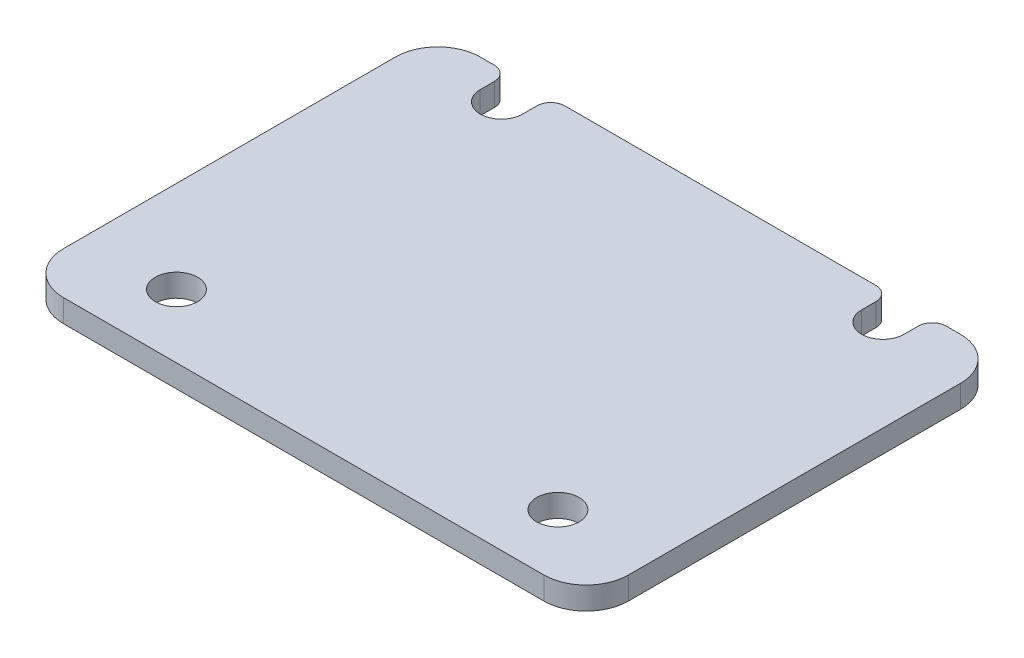
from build123d import *

# Parameters (mm, degrees)
SKETCH1_W                = 40
SKETCH1_H                = 29.5
BOSS_EXTRUDE1_DEPTH      = 1.6
FILLET1_R                = 3
M2_CLEARANCE_HOLE1_D     = 3
M2_CLEARANCE_HOLE1_DEPTH = 5.2
M2_CLEARANCE_HOLE1_TIP   = 0.901290929
CUT_EXTRUDE1_DEPTH       = 25.902258934
CUT_EXTRUDE1_DEPTH_BACK  = 25.902258934
FILLET2_R                = 1
SKETCH11_W               = 30
SKETCH11_H               = 28.944863729
SKETCH11_R               = 1
CUT_EXTRUDE3_DEPTH       = 0.001


with BuildPart() as part:
    # Sketch1 → Boss-Extrude1 (new body)
    with BuildSketch(Plane(origin=(0, 0, 0), x_dir=(1, 0, 0), z_dir=(0, 1, 0))):
        Rectangle(SKETCH1_W, SKETCH1_H)
    extrude(amount=BOSS_EXTRUDE1_DEPTH)

    # Fillet1
    fillet1_edges = [part.edges().sort_by_distance(p)[0] for p in [
        (20, 0.8, -14.75),
        (20, 0.8, 14.75),
        (-20, 0.8, 14.75),
        (-20, 0.8, -14.75),
    ]]
    fillet(fillet1_edges, radius=FILLET1_R)

    # M2 Clearance Hole1
    with Locations(Plane(origin=(0, 1.6, 0), x_dir=(1, 0, 0), z_dir=(0, 1, 0))):
        with Locations((-13.5, 12.75), (13.5, 12.75), (13.5, -10.25), (-13.5, -10.25)):
            Hole(M2_CLEARANCE_HOLE1_D / 2, depth=M2_CLEARANCE_HOLE1_DEPTH)
            with Locations((0, 0, -(M2_CLEARANCE_HOLE1_DEPTH + M2_CLEARANCE_HOLE1_TIP / 2))):  # 118° drill point
                Cone(0, M2_CLEARANCE_HOLE1_D / 2, M2_CLEARANCE_HOLE1_TIP, mode=Mode.SUBTRACT)

    # Sketch5 → Cut-Extrude1 (cut, two sides: drawn at the far end of the back side and taken through both)
    with BuildSketch(Plane(origin=(0, 1.6, 0), x_dir=(1, 0, 0), z_dir=(0, 1, 0)).offset(-CUT_EXTRUDE1_DEPTH_BACK)):
        with BuildLine():
            Line((-15, 12.75), (-15, 19.75))
            ThreePointArc((-15, 19.75), (-13.5, 21.25), (-12, 19.75))
            Line((-12, 19.75), (-12, 12.75))
            ThreePointArc((-12, 12.75), (-13.5, 11.25), (-15, 12.75))
        make_face()
        with BuildLine():
            Line((15, 12.75), (15, 19.75))
            ThreePointArc((15, 19.75), (13.5, 21.25), (12, 19.75))
            Line((12, 19.75), (12, 12.75))
            ThreePointArc((12, 12.75), (13.5, 11.25), (15, 12.75))
        make_face()
    extrude(amount=CUT_EXTRUDE1_DEPTH + CUT_EXTRUDE1_DEPTH_BACK, mode=Mode.SUBTRACT)

    # Fillet2
    fillet2_edges = [part.edges().sort_by_distance(p)[0] for p in [
        (15, 0.8, -14.75),
        (12, 0.8, -14.75),
        (-12, 0.8, -14.75),
        (-15, 0.8, -14.75),
    ]]
    fillet(fillet2_edges, radius=FILLET2_R)

    # Sketch11 → Cut-Extrude3 (cut)
    with BuildSketch(Plane.XZ):
        with Locations((0, -0.277568136)):
            Rectangle(SKETCH11_W, SKETCH11_H)
        with Locations((13.5, -12.75)):
            Circle(SKETCH11_R, mode=Mode.SUBTRACT)
        with Locations((13.5, 10.25)):
            Circle(SKETCH11_R, mode=Mode.SUBTRACT)
        with Locations((-13.5, -12.75)):
            Circle(SKETCH11_R, mode=Mode.SUBTRACT)
        with Locations((-13.5, 10.25)):
            Circle(SKETCH11_R, mode=Mode.SUBTRACT)
        with BuildLine():
            Line((-10, 11.694863729), (10, 11.694863729))
            ThreePointArc((10, 11.694863729), (11.434632325, 11.088706998), (12, 9.637516011))
            Line((12, 9.637516011), (12, -9.74800182))
            add(Edge.make_bspline(
                [(10, -11.748801092), (12, -11.748801092), (12, -9.74800182)],
                knots=[3.141592654, 3.141592654, 3.141592654, 4.71238898, 4.71238898, 4.71238898], degree=2, weights=[1, 0.707106781, 1]))
            Line((10, -11.748801092), (-10, -11.748801092))
            add(Edge.make_bspline(
                [(-12, -9.74800182), (-12, -11.748801092), (-10, -11.748801092)],
                knots=[1.570796327, 1.570796327, 1.570796327, 3.141592654, 3.141592654, 3.141592654], degree=2, weights=[1, 0.707106781, 1]))
            Line((-12, -9.74800182), (-12, 9.750612903))
            ThreePointArc((-12, 9.750612903), (-11.394642541, 11.128696782), (-10, 11.694863729))
        make_face(mode=Mode.SUBTRACT)
    extrude(amount=-CUT_EXTRUDE3_DEPTH, mode=Mode.SUBTRACT)


solid = part.part
